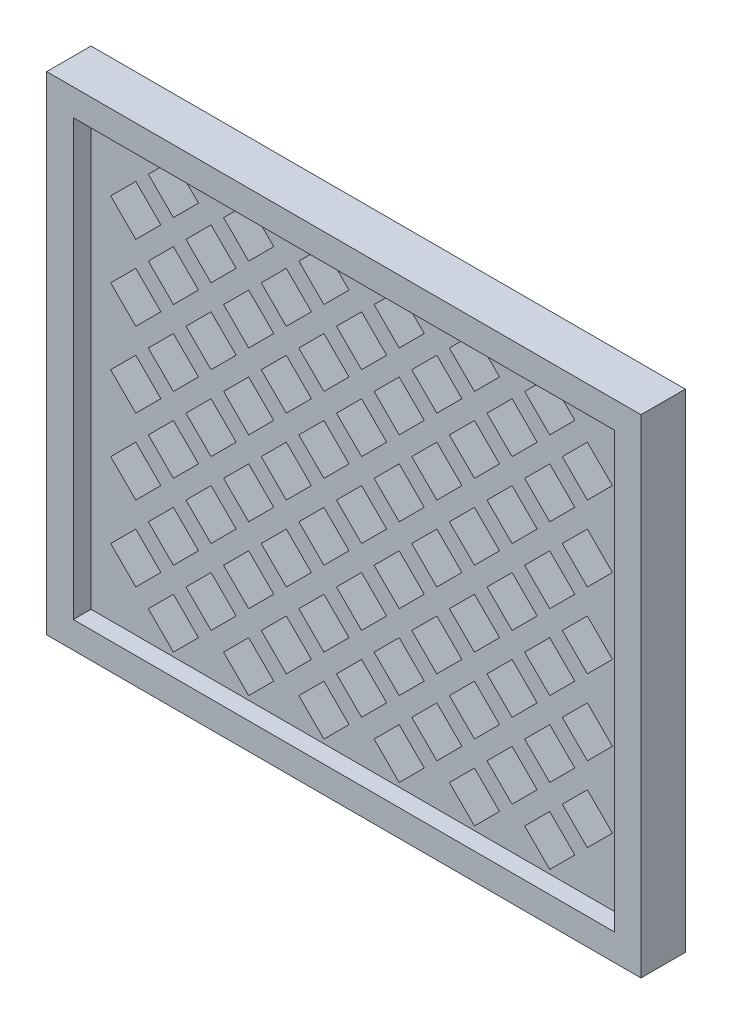
from build123d import *

# Parameters (mm, degrees)
SKETCH_1_W           = 67
SKETCH_1_H           = 55
EXTRUDE_1_DEPTH      = 3
SKETCH_2_W           = 37
SKETCH_2_H           = 3
EXTRUDE_2_DEPTH      = 10
CUT_EXTRUDE_1_REACH  = 89.653
OTHER_START          = -3.757359313
OTHER_1_OUTLINE_W    = 4
OTHER_1_OUTLINE_H    = 3
OTHER_1_DEPTH        = 4
OTHER_START_2        = 2.242640687
OTHER_1_2_OUTLINE_W  = 4
OTHER_1_2_OUTLINE_H  = 3
OTHER_1_2_DEPTH      = 4
OTHER_START_3        = 8.242640687
OTHER_1_3_OUTLINE_W  = 4
OTHER_1_3_OUTLINE_H  = 3
OTHER_1_3_DEPTH      = 4
OTHER_START_4        = -9.757359313
OTHER_1_4_OUTLINE_W  = 4
OTHER_1_4_OUTLINE_H  = 3
OTHER_1_4_DEPTH      = 4
OTHER_START_5        = 14.242640687
OTHER_1_5_OUTLINE_W  = 4
OTHER_1_5_OUTLINE_H  = 3
OTHER_1_5_DEPTH      = 4
OTHER_START_6        = -15.757359313
OTHER_1_6_OUTLINE_W  = 4
OTHER_1_6_OUTLINE_H  = 3
OTHER_1_6_DEPTH      = 4
OTHER_START_7        = 20.242640687
OTHER_1_7_OUTLINE_W  = 4
OTHER_1_7_OUTLINE_H  = 3
OTHER_1_7_DEPTH      = 4
OTHER_START_8        = -21.757359313
OTHER_1_8_OUTLINE_W  = 4
OTHER_1_8_OUTLINE_H  = 3
OTHER_1_8_DEPTH      = 4
OTHER_START_9        = 26.242640687
OTHER_1_9_OUTLINE_W  = 4
OTHER_1_9_OUTLINE_H  = 3
OTHER_1_9_DEPTH      = 4
OTHER_START_10       = -27.757359313
OTHER_1_10_OUTLINE_W = 4
OTHER_1_10_OUTLINE_H = 3
OTHER_1_10_DEPTH     = 4
OTHER_START_11       = 32.242640687
OTHER_1_11_OUTLINE_W = 4
OTHER_1_11_OUTLINE_H = 3
OTHER_1_11_DEPTH     = 4
SKETCH_5_W           = 67
SKETCH_5_H           = 55
SKETCH_5_W_2         = 61
SKETCH_5_H_2         = 49
EXTRUDE_3_DEPTH      = 2
CUT_EXTRUDE_2_REACH  = 87.399
SKETCH_6_R           = 1.65


# Read off the part's stored shape, not the designer's step: 填充阵列1
with BuildPart() as part:
    # 草图1 → 凸台-拉伸1 (new body)
    with BuildSketch(Plane.XY):
        with Locations((33.5, -27.5)):
            Rectangle(SKETCH_1_W, SKETCH_1_H)
    extrude(amount=EXTRUDE_1_DEPTH)

    # 草图2 → 凸台-拉伸2 (add)
    with BuildSketch(Plane(origin=(0, 0, 0), x_dir=(-1, 0, 0), z_dir=(0, 0, -1))):
        with Locations((-33.5, -53.5)):
            Rectangle(SKETCH_2_W, SKETCH_2_H)
    extrude(amount=EXTRUDE_2_DEPTH)

    # 草图4 → 切除-拉伸1 (cut, up to next)
    with BuildSketch(Plane.XY.offset(3), mode=Mode.PRIVATE) as cut_extrude_1_sk1:
        Polygon((33.5, -24.671572875), (30.671572875, -27.5), (33.5, -30.328427125), (36.328427125, -27.5), align=None)
    cut_extrude_1_tool1 = extrude(cut_extrude_1_sk1.sketch, amount=-CUT_EXTRUDE_1_REACH, mode=Mode.PRIVATE) & part.part
    add(cut_extrude_1_tool1.solids().sort_by_distance((33.5, -27.5, 3))[0], mode=Mode.SUBTRACT)

    # 填充阵列1 outline → 填充阵列1 (cut)
    with BuildSketch(Plane(origin=(0, 0, 0), x_dir=(0.707106781186548, -0.707106781186547, 0), z_dir=(0.707106781186547, 0.707106781186548, 0)).offset(OTHER_START)):
        with Locations((43.133513652, -1.5)):
            Rectangle(OTHER_1_OUTLINE_W, OTHER_1_OUTLINE_H)
        with Locations((49.133513652, -1.5)):
            Rectangle(OTHER_1_OUTLINE_W, OTHER_1_OUTLINE_H)
        with Locations((37.133513652, -1.5)):
            Rectangle(OTHER_1_OUTLINE_W, OTHER_1_OUTLINE_H)
        with Locations((55.133513652, -1.5)):
            Rectangle(OTHER_1_OUTLINE_W, OTHER_1_OUTLINE_H)
        with Locations((31.133513652, -1.5)):
            Rectangle(OTHER_1_OUTLINE_W, OTHER_1_OUTLINE_H)
        with Locations((61.133513652, -1.5)):
            Rectangle(OTHER_1_OUTLINE_W, OTHER_1_OUTLINE_H)
        with Locations((25.133513652, -1.5)):
            Rectangle(OTHER_1_OUTLINE_W, OTHER_1_OUTLINE_H)
        with Locations((67.133513652, -1.5)):
            Rectangle(OTHER_1_OUTLINE_W, OTHER_1_OUTLINE_H)
        with Locations((19.133513652, -1.5)):
            Rectangle(OTHER_1_OUTLINE_W, OTHER_1_OUTLINE_H)
        with Locations((13.133513652, -1.5)):
            Rectangle(OTHER_1_OUTLINE_W, OTHER_1_OUTLINE_H)
    extrude(amount=OTHER_1_DEPTH, mode=Mode.SUBTRACT)

    # Other 1 2 outline → Other 1 2 (cut)
    with BuildSketch(Plane(origin=(0, 0, 0), x_dir=(0.707106781186548, -0.707106781186547, 0), z_dir=(0.707106781186547, 0.707106781186548, 0)).offset(OTHER_START_2)):
        with Locations((49.133513652, -1.5)):
            Rectangle(OTHER_1_2_OUTLINE_W, OTHER_1_2_OUTLINE_H)
        with Locations((37.133513652, -1.5)):
            Rectangle(OTHER_1_2_OUTLINE_W, OTHER_1_2_OUTLINE_H)
        with Locations((55.133513652, -1.5)):
            Rectangle(OTHER_1_2_OUTLINE_W, OTHER_1_2_OUTLINE_H)
        with Locations((31.133513652, -1.5)):
            Rectangle(OTHER_1_2_OUTLINE_W, OTHER_1_2_OUTLINE_H)
        with Locations((61.133513652, -1.5)):
            Rectangle(OTHER_1_2_OUTLINE_W, OTHER_1_2_OUTLINE_H)
        with Locations((25.133513652, -1.5)):
            Rectangle(OTHER_1_2_OUTLINE_W, OTHER_1_2_OUTLINE_H)
        with Locations((67.133513652, -1.5)):
            Rectangle(OTHER_1_2_OUTLINE_W, OTHER_1_2_OUTLINE_H)
        with Locations((19.133513652, -1.5)):
            Rectangle(OTHER_1_2_OUTLINE_W, OTHER_1_2_OUTLINE_H)
        with Locations((73.133513652, -1.5)):
            Rectangle(OTHER_1_2_OUTLINE_W, OTHER_1_2_OUTLINE_H)
        with Locations((13.133513652, -1.5)):
            Rectangle(OTHER_1_2_OUTLINE_W, OTHER_1_2_OUTLINE_H)
    extrude(amount=OTHER_1_2_DEPTH, mode=Mode.SUBTRACT)

    # Other 1 3 outline → Other 1 3 (cut)
    with BuildSketch(Plane(origin=(0, 0, 0), x_dir=(0.707106781186548, -0.707106781186547, 0), z_dir=(0.707106781186547, 0.707106781186548, 0)).offset(OTHER_START_3)):
        with Locations((43.133513652, -1.5)):
            Rectangle(OTHER_1_3_OUTLINE_W, OTHER_1_3_OUTLINE_H)
        with Locations((49.133513652, -1.5)):
            Rectangle(OTHER_1_3_OUTLINE_W, OTHER_1_3_OUTLINE_H)
        with Locations((37.133513652, -1.5)):
            Rectangle(OTHER_1_3_OUTLINE_W, OTHER_1_3_OUTLINE_H)
        with Locations((55.133513652, -1.5)):
            Rectangle(OTHER_1_3_OUTLINE_W, OTHER_1_3_OUTLINE_H)
        with Locations((31.133513652, -1.5)):
            Rectangle(OTHER_1_3_OUTLINE_W, OTHER_1_3_OUTLINE_H)
        with Locations((61.133513652, -1.5)):
            Rectangle(OTHER_1_3_OUTLINE_W, OTHER_1_3_OUTLINE_H)
        with Locations((25.133513652, -1.5)):
            Rectangle(OTHER_1_3_OUTLINE_W, OTHER_1_3_OUTLINE_H)
        with Locations((67.133513652, -1.5)):
            Rectangle(OTHER_1_3_OUTLINE_W, OTHER_1_3_OUTLINE_H)
        with Locations((19.133513652, -1.5)):
            Rectangle(OTHER_1_3_OUTLINE_W, OTHER_1_3_OUTLINE_H)
        with Locations((73.133513652, -1.5)):
            Rectangle(OTHER_1_3_OUTLINE_W, OTHER_1_3_OUTLINE_H)
    extrude(amount=OTHER_1_3_DEPTH, mode=Mode.SUBTRACT)

    # Other 1 4 outline → Other 1 4 (cut)
    with BuildSketch(Plane(origin=(0, 0, 0), x_dir=(0.707106781186548, -0.707106781186547, 0), z_dir=(0.707106781186547, 0.707106781186548, 0)).offset(OTHER_START_4)):
        with Locations((43.133513652, -1.5)):
            Rectangle(OTHER_1_4_OUTLINE_W, OTHER_1_4_OUTLINE_H)
        with Locations((49.133513652, -1.5)):
            Rectangle(OTHER_1_4_OUTLINE_W, OTHER_1_4_OUTLINE_H)
        with Locations((37.133513652, -1.5)):
            Rectangle(OTHER_1_4_OUTLINE_W, OTHER_1_4_OUTLINE_H)
        with Locations((55.133513652, -1.5)):
            Rectangle(OTHER_1_4_OUTLINE_W, OTHER_1_4_OUTLINE_H)
        with Locations((31.133513652, -1.5)):
            Rectangle(OTHER_1_4_OUTLINE_W, OTHER_1_4_OUTLINE_H)
        with Locations((61.133513652, -1.5)):
            Rectangle(OTHER_1_4_OUTLINE_W, OTHER_1_4_OUTLINE_H)
        with Locations((25.133513652, -1.5)):
            Rectangle(OTHER_1_4_OUTLINE_W, OTHER_1_4_OUTLINE_H)
        with Locations((19.133513652, -1.5)):
            Rectangle(OTHER_1_4_OUTLINE_W, OTHER_1_4_OUTLINE_H)
    extrude(amount=OTHER_1_4_DEPTH, mode=Mode.SUBTRACT)

    # Other 1 5 outline → Other 1 5 (cut)
    with BuildSketch(Plane(origin=(0, 0, 0), x_dir=(0.707106781186548, -0.707106781186547, 0), z_dir=(0.707106781186547, 0.707106781186548, 0)).offset(OTHER_START_5)):
        with Locations((43.133513652, -1.5)):
            Rectangle(OTHER_1_5_OUTLINE_W, OTHER_1_5_OUTLINE_H)
        with Locations((49.133513652, -1.5)):
            Rectangle(OTHER_1_5_OUTLINE_W, OTHER_1_5_OUTLINE_H)
        with Locations((37.133513652, -1.5)):
            Rectangle(OTHER_1_5_OUTLINE_W, OTHER_1_5_OUTLINE_H)
        with Locations((55.133513652, -1.5)):
            Rectangle(OTHER_1_5_OUTLINE_W, OTHER_1_5_OUTLINE_H)
        with Locations((31.133513652, -1.5)):
            Rectangle(OTHER_1_5_OUTLINE_W, OTHER_1_5_OUTLINE_H)
        with Locations((61.133513652, -1.5)):
            Rectangle(OTHER_1_5_OUTLINE_W, OTHER_1_5_OUTLINE_H)
        with Locations((25.133513652, -1.5)):
            Rectangle(OTHER_1_5_OUTLINE_W, OTHER_1_5_OUTLINE_H)
        with Locations((67.133513652, -1.5)):
            Rectangle(OTHER_1_5_OUTLINE_W, OTHER_1_5_OUTLINE_H)
    extrude(amount=OTHER_1_5_DEPTH, mode=Mode.SUBTRACT)

    # Other 1 6 outline → Other 1 6 (cut)
    with BuildSketch(Plane(origin=(0, 0, 0), x_dir=(0.707106781186548, -0.707106781186547, 0), z_dir=(0.707106781186547, 0.707106781186548, 0)).offset(OTHER_START_6)):
        with Locations((43.133513652, -1.5)):
            Rectangle(OTHER_1_6_OUTLINE_W, OTHER_1_6_OUTLINE_H)
        with Locations((49.133513652, -1.5)):
            Rectangle(OTHER_1_6_OUTLINE_W, OTHER_1_6_OUTLINE_H)
        with Locations((37.133513652, -1.5)):
            Rectangle(OTHER_1_6_OUTLINE_W, OTHER_1_6_OUTLINE_H)
        with Locations((55.133513652, -1.5)):
            Rectangle(OTHER_1_6_OUTLINE_W, OTHER_1_6_OUTLINE_H)
        with Locations((31.133513652, -1.5)):
            Rectangle(OTHER_1_6_OUTLINE_W, OTHER_1_6_OUTLINE_H)
        with Locations((25.133513652, -1.5)):
            Rectangle(OTHER_1_6_OUTLINE_W, OTHER_1_6_OUTLINE_H)
    extrude(amount=OTHER_1_6_DEPTH, mode=Mode.SUBTRACT)

    # Other 1 7 outline → Other 1 7 (cut)
    with BuildSketch(Plane(origin=(0, 0, 0), x_dir=(0.707106781186548, -0.707106781186547, 0), z_dir=(0.707106781186547, 0.707106781186548, 0)).offset(OTHER_START_7)):
        with Locations((43.133513652, -1.5)):
            Rectangle(OTHER_1_7_OUTLINE_W, OTHER_1_7_OUTLINE_H)
        with Locations((49.133513652, -1.5)):
            Rectangle(OTHER_1_7_OUTLINE_W, OTHER_1_7_OUTLINE_H)
        with Locations((37.133513652, -1.5)):
            Rectangle(OTHER_1_7_OUTLINE_W, OTHER_1_7_OUTLINE_H)
        with Locations((55.133513652, -1.5)):
            Rectangle(OTHER_1_7_OUTLINE_W, OTHER_1_7_OUTLINE_H)
        with Locations((31.133513652, -1.5)):
            Rectangle(OTHER_1_7_OUTLINE_W, OTHER_1_7_OUTLINE_H)
        with Locations((61.133513652, -1.5)):
            Rectangle(OTHER_1_7_OUTLINE_W, OTHER_1_7_OUTLINE_H)
    extrude(amount=OTHER_1_7_DEPTH, mode=Mode.SUBTRACT)

    # Other 1 8 outline → Other 1 8 (cut)
    with BuildSketch(Plane(origin=(0, 0, 0), x_dir=(0.707106781186548, -0.707106781186547, 0), z_dir=(0.707106781186547, 0.707106781186548, 0)).offset(OTHER_START_8)):
        with Locations((43.133513652, -1.5)):
            Rectangle(OTHER_1_8_OUTLINE_W, OTHER_1_8_OUTLINE_H)
        with Locations((49.133513652, -1.5)):
            Rectangle(OTHER_1_8_OUTLINE_W, OTHER_1_8_OUTLINE_H)
        with Locations((37.133513652, -1.5)):
            Rectangle(OTHER_1_8_OUTLINE_W, OTHER_1_8_OUTLINE_H)
        with Locations((31.133513652, -1.5)):
            Rectangle(OTHER_1_8_OUTLINE_W, OTHER_1_8_OUTLINE_H)
    extrude(amount=OTHER_1_8_DEPTH, mode=Mode.SUBTRACT)

    # Other 1 9 outline → Other 1 9 (cut)
    with BuildSketch(Plane(origin=(0, 0, 0), x_dir=(0.707106781186548, -0.707106781186547, 0), z_dir=(0.707106781186547, 0.707106781186548, 0)).offset(OTHER_START_9)):
        with Locations((43.133513652, -1.5)):
            Rectangle(OTHER_1_9_OUTLINE_W, OTHER_1_9_OUTLINE_H)
        with Locations((49.133513652, -1.5)):
            Rectangle(OTHER_1_9_OUTLINE_W, OTHER_1_9_OUTLINE_H)
        with Locations((37.133513652, -1.5)):
            Rectangle(OTHER_1_9_OUTLINE_W, OTHER_1_9_OUTLINE_H)
        with Locations((55.133513652, -1.5)):
            Rectangle(OTHER_1_9_OUTLINE_W, OTHER_1_9_OUTLINE_H)
    extrude(amount=OTHER_1_9_DEPTH, mode=Mode.SUBTRACT)

    # Other 1 10 outline → Other 1 10 (cut)
    with BuildSketch(Plane(origin=(0, 0, 0), x_dir=(0.707106781186548, -0.707106781186547, 0), z_dir=(0.707106781186547, 0.707106781186548, 0)).offset(OTHER_START_10)):
        with Locations((43.133513652, -1.5)):
            Rectangle(OTHER_1_10_OUTLINE_W, OTHER_1_10_OUTLINE_H)
        with Locations((37.133513652, -1.5)):
            Rectangle(OTHER_1_10_OUTLINE_W, OTHER_1_10_OUTLINE_H)
    extrude(amount=OTHER_1_10_DEPTH, mode=Mode.SUBTRACT)

    # Other 1 11 outline → Other 1 11 (cut)
    with BuildSketch(Plane(origin=(0, 0, 0), x_dir=(0.707106781186548, -0.707106781186547, 0), z_dir=(0.707106781186547, 0.707106781186548, 0)).offset(OTHER_START_11)):
        with Locations((43.133513652, -1.5)):
            Rectangle(OTHER_1_11_OUTLINE_W, OTHER_1_11_OUTLINE_H)
        with Locations((49.133513652, -1.5)):
            Rectangle(OTHER_1_11_OUTLINE_W, OTHER_1_11_OUTLINE_H)
    extrude(amount=OTHER_1_11_DEPTH, mode=Mode.SUBTRACT)

    # 草图5 → 凸台-拉伸3 (add)
    with BuildSketch(Plane.XY.offset(3)):
        with Locations((33.5, -27.5)):
            Rectangle(SKETCH_5_W, SKETCH_5_H)
        with Locations((33.5, -27.5)):
            Rectangle(SKETCH_5_W_2, SKETCH_5_H_2, mode=Mode.SUBTRACT)
    extrude(amount=EXTRUDE_3_DEPTH)

    # 草图6 → 切除-拉伸2 (cut, up to next)
    with BuildSketch(Plane(origin=(0, -52, 0), x_dir=(1, 0, 0), z_dir=(0, 1, 0)), mode=Mode.PRIVATE) as cut_extrude_2_sk1:
        with Locations(Location((18.50000004, 4.593107217, 0), (0, 0, 270))):
            Circle(SKETCH_6_R)
    cut_extrude_2_tool1 = extrude(cut_extrude_2_sk1.sketch, amount=-CUT_EXTRUDE_2_REACH, mode=Mode.PRIVATE) & part.part
    # 草图6 → 切除-拉伸2 (cut, up to next)
    with BuildSketch(Plane(origin=(0, -52, 0), x_dir=(1, 0, 0), z_dir=(0, 1, 0)), mode=Mode.PRIVATE) as cut_extrude_2_sk2:
        with Locations(Location((48.5, 4.591558355, 0), (0, 0, 270))):
            Circle(SKETCH_6_R)
    cut_extrude_2_tool2 = extrude(cut_extrude_2_sk2.sketch, amount=-CUT_EXTRUDE_2_REACH, mode=Mode.PRIVATE) & part.part
    add(cut_extrude_2_tool1.solids().sort_by_distance((18.5, -52, -4.593107))[0], mode=Mode.SUBTRACT)
    add(cut_extrude_2_tool2.solids().sort_by_distance((48.5, -52, -4.591558))[0], mode=Mode.SUBTRACT)


solid = part.part
